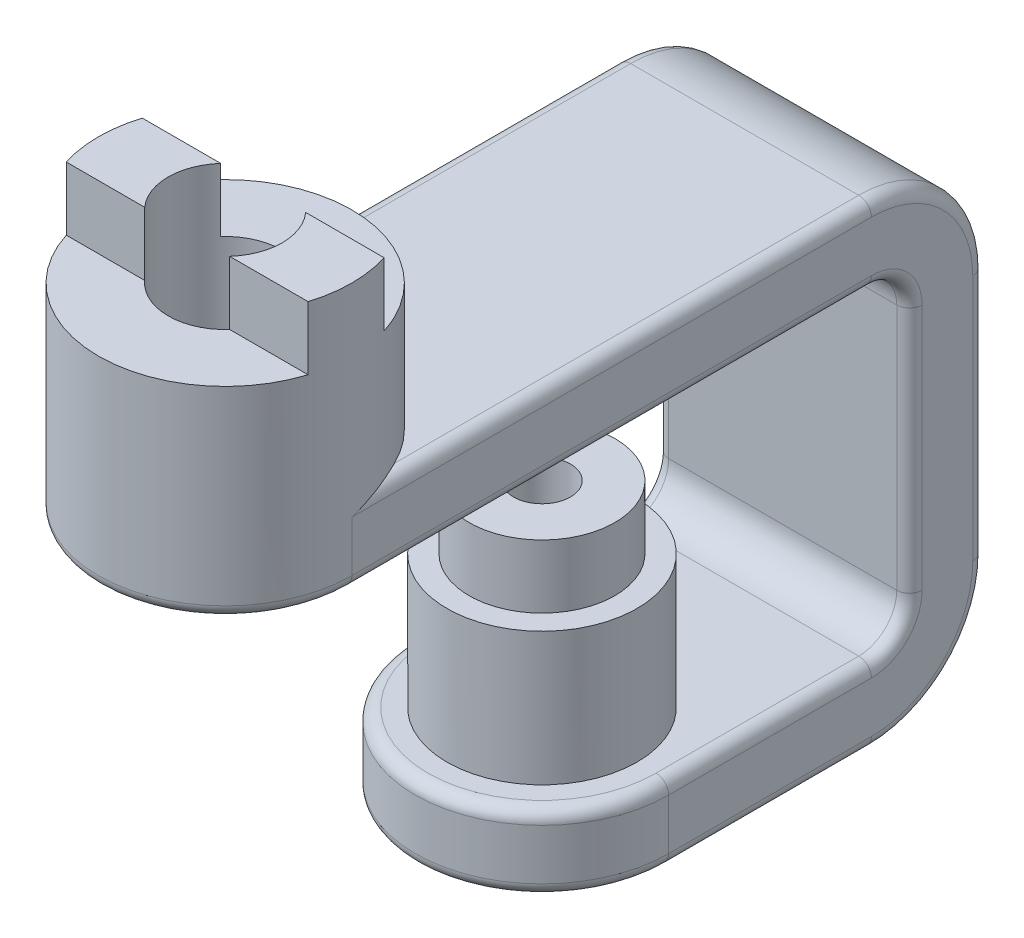
from build123d import *

# Parameters (mm, degrees)
EXTRUDE_THIN1_DEPTH                       = 20
SKETCH2_R                                 = 20
BOSS_EXTRUDE1_DEPTH                       = 42
FILLET1_RADIUS                            = 20
FILLET1_LENGTH                            = 12
SKETCH3_R                                 = 15
BOSS_EXTRUDE2_DEPTH                       = 21
SKETCH4_R                                 = 11.5
BOSS_EXTRUDE3_DEPTH                       = 10
CUT_EXTRUDE1_START                        = -10
CUT_EXTRUDE1_DEPTH                        = 10
F_18_0_18_DIAMETER_HOLE1_D                = 18
CBORE_FOR_M8_HEX_HEAD_BOLT1_OUTLINE_R     = 4.5
CBORE_FOR_M8_HEX_HEAD_BOLT1_DEPTH         = 43
CBORE_FOR_M8_HEX_HEAD_BOLT1_2_OUTLINE_R   = 9.005
CBORE_FOR_M8_HEX_HEAD_BOLT1_2_OUTLINE_R_2 = 4.5
CBORE_FOR_M8_HEX_HEAD_BOLT1_2_DEPTH       = 5.68
FILLET2_R                                 = 2


# Read off the part's stored shape, not the designer's step: CBORE for M8 Hex Head Bolt1
with BuildPart() as part:
    # Sketch1 → Extrude-Thin1 (new, symmetric)
    with BuildSketch(Plane(origin=(0, 0, 0), x_dir=(0, 0, -1), z_dir=(1, 0, 0))):
        with BuildLine():
            Line((0, 0), (52, 0))
            ThreePointArc((52, 0), (64.727922061, 5.272077939), (70, 18))
            Line((70, 18), (70, 57))
            ThreePointArc((70, 57), (64.727922061, 69.727922061), (52, 75))
            Line((52, 75), (-30, 75))
            Line((-30, 75), (-30, 63))
            Line((-30, 63), (52, 63))
            ThreePointArc((52, 63), (56.242640687, 61.242640687), (58, 57))
            Line((58, 57), (58, 18))
            ThreePointArc((58, 18), (56.242640687, 13.757359313), (52, 12))
            Line((52, 12), (0, 12))
            Line((0, 12), (0, 0))
        make_face()
    extrude(amount=EXTRUDE_THIN1_DEPTH, both=True)

    # Sketch2 → Boss-Extrude1 (add)
    with BuildSketch(Plane.XZ.offset(-63)):
        with Locations(Location((0, 30, 0), (0, 0, 270))):
            Circle(SKETCH2_R)
    extrude(amount=-BOSS_EXTRUDE1_DEPTH)

    # Fillet1: full round fillet: the end face becomes a half cylinder, R = half its width
    fillet1_face = Plane((0, 6, 0), x_dir=(0, -1, 0), z_dir=(0, 0, 1))  # on the end face: x along it, z out of the body
    fillet1_slab = fillet1_face.offset(-FILLET1_RADIUS / 2) * Box(FILLET1_LENGTH, 2 * FILLET1_RADIUS, FILLET1_RADIUS, mode=Mode.PRIVATE)  # the body's end, R deep
    fillet1_round = Plane((0, 6, -20), x_dir=(0, 0, 1), z_dir=(0, -1, 0)) * Cylinder(FILLET1_RADIUS, FILLET1_LENGTH, mode=Mode.PRIVATE)  # its axis R under the face
    add(fillet1_slab - fillet1_round, mode=Mode.SUBTRACT)

    # Sketch3 → Boss-Extrude2 (add)
    with BuildSketch(Plane(origin=(0, 12, 0), x_dir=(1, 0, 0), z_dir=(0, 1, 0))):
        with Locations(Location((0, 20, 0), (0, 0, 90))):
            Circle(SKETCH3_R)
    extrude(amount=BOSS_EXTRUDE2_DEPTH)

    # Sketch4 → Boss-Extrude3 (add)
    with BuildSketch(Plane(origin=(0, 33, 0), x_dir=(1, 0, 0), z_dir=(0, 1, 0))):
        with Locations(Location((0, 20, 0), (0, 0, 90))):
            Circle(SKETCH4_R)
    extrude(amount=BOSS_EXTRUDE3_DEPTH)

    # Sketch5 → Cut-Extrude1 (cut)
    with BuildSketch(Plane(origin=(0, 105, 0), x_dir=(1, 0, 0), z_dir=(0, 1, 0)).offset(CUT_EXTRUDE1_START)):
        with BuildLine():
            Line((-19.078784028, -24), (19.078784028, -24))
            ThreePointArc((19.078784028, -24), (0, -10), (-19.078784028, -24))
        make_face()
        with BuildLine():
            Line((-19.078784028, -36), (19.078784028, -36))
            ThreePointArc((19.078784028, -36), (0, -50), (-19.078784028, -36))
        make_face()
    extrude(amount=CUT_EXTRUDE1_DEPTH, mode=Mode.SUBTRACT)

    # Ø18.0 (18) Diameter Hole1 (through all)
    with Locations(Plane(origin=(0, 63, 0), x_dir=(-1, 0, 0), z_dir=(0, -1, 0))):
        with Locations((0, -30)):
            Hole(F_18_0_18_DIAMETER_HOLE1_D / 2)

    # CBORE for M8 Hex Head Bolt1 outline → CBORE for M8 Hex Head Bolt1 (cut)
    with BuildSketch(Plane(origin=(0, 0, 0), x_dir=(1, 0, 0), z_dir=(0, 1, 0))):
        with Locations((0, 20)):
            Circle(CBORE_FOR_M8_HEX_HEAD_BOLT1_OUTLINE_R)
    extrude(amount=CBORE_FOR_M8_HEX_HEAD_BOLT1_DEPTH, mode=Mode.SUBTRACT)

    # CBORE for M8 Hex Head Bolt1 2 outline → CBORE for M8 Hex Head Bolt1 2 (cut)
    with BuildSketch(Plane(origin=(0, 0, 0), x_dir=(1, 0, 0), z_dir=(0, 1, 0))):
        with Locations((0, 20)):
            Circle(CBORE_FOR_M8_HEX_HEAD_BOLT1_2_OUTLINE_R)
        with Locations((0, 20)):
            Circle(CBORE_FOR_M8_HEX_HEAD_BOLT1_2_OUTLINE_R_2, mode=Mode.SUBTRACT)
    extrude(amount=CBORE_FOR_M8_HEX_HEAD_BOLT1_2_DEPTH, mode=Mode.SUBTRACT)

    # Fillet2
    # the kernel refuses this fillet: 2 mm, written as the material it takes off along each edge
    with BuildSketch(Plane(origin=(20, 63, 30), x_dir=(0, 1, 0), z_dir=(0, 0, -1))) as fillet2_piece_1:
        with BuildLine():
            CenterArc((FILLET2_R, -FILLET2_R), FILLET2_R, 90, 90)
            Line((0, -FILLET2_R), (0, 0))
            Line((0, 0), (FILLET2_R, 0))
        make_face()
    extrude(amount=82, mode=Mode.SUBTRACT)
    with BuildSketch(Plane(origin=(-20, 18, -52), x_dir=(0, 0, -1), z_dir=(0, 1, 0))) as fillet2_piece_2:
        with BuildLine():
            CenterArc((6 + FILLET2_R, -FILLET2_R), FILLET2_R, 90, 90)
            Line((6 + FILLET2_R, 0), (6, 0))
            Line((6, 0), (6, -FILLET2_R))
        make_face()
    revolve(axis=Axis((-20, 18, -52), (-1, 0, 0)), revolution_arc=90, mode=Mode.SUBTRACT)
    with BuildSketch(Plane(origin=(-20, 57, -58), x_dir=(0, 0, -1), z_dir=(0, -1, 0)), Plane(origin=(-20, 18, -70), x_dir=(0, 0, 1), z_dir=(0, 1, 0))) as fillet2_piece_3:
        with BuildLine():
            CenterArc((FILLET2_R, FILLET2_R), FILLET2_R, 180, 90)
            Line((0, FILLET2_R), (0, 0))
            Line((0, 0), (FILLET2_R, 0))
        make_face()
    extrude(amount=39, mode=Mode.SUBTRACT)
    with BuildSketch(Plane(origin=(-20, 57, -52), x_dir=(0, 1, 0), z_dir=(0, 0, 1))) as fillet2_piece_4:
        with BuildLine():
            CenterArc((6 + FILLET2_R, -FILLET2_R), FILLET2_R, 90, 90)
            Line((6, -FILLET2_R), (6, 0))
            Line((6, 0), (6 + FILLET2_R, 0))
        make_face()
    revolve(axis=Axis((-20, 57, -52), (-1, 0, 0)), revolution_arc=90, mode=Mode.SUBTRACT)
    with BuildSketch(Plane(origin=(-20, 63, 30), x_dir=(0, 1, 0), z_dir=(0, 0, -1))) as fillet2_piece_5:
        with BuildLine():
            CenterArc((FILLET2_R, FILLET2_R), FILLET2_R, 180, 90)
            Line((0, FILLET2_R), (0, 0))
            Line((0, 0), (FILLET2_R, 0))
        make_face()
    extrude(amount=82, mode=Mode.SUBTRACT)
    with BuildSketch(Plane(origin=(-20, 75, -52), x_dir=(0, -1, 0), z_dir=(0, 0, 1))) as fillet2_piece_6_section:
        with BuildLine():
            CenterArc((FILLET2_R, FILLET2_R), FILLET2_R, 180, 90)
            Line((0, FILLET2_R), (0, 0))
            Line((0, 0), (FILLET2_R, 0))
        make_face()
    fillet2_piece_6 = extrude(amount=87, mode=Mode.PRIVATE)
    fillet2_piece_6 = fillet2_piece_6 - Plane(origin=(0, 74.534164155, 30), x_dir=(0, 0, -1), z_dir=(0, -1, 0)) * Cylinder(20, 182, mode=Mode.PRIVATE)
    add(fillet2_piece_6, mode=Mode.SUBTRACT)
    with BuildSketch(Plane(origin=(20, 57, -52), x_dir=(0, 1, 0), z_dir=(0, 0, 1))) as fillet2_piece_7:
        with BuildLine():
            CenterArc((6 + FILLET2_R, FILLET2_R), FILLET2_R, 180, 90)
            Line((6, FILLET2_R), (6, 0))
            Line((6, 0), (6 + FILLET2_R, 0))
        make_face()
    revolve(axis=Axis((20, 57, -52), (-1, 0, 0)), revolution_arc=90, mode=Mode.SUBTRACT)
    with BuildSketch(Plane(origin=(20, 57, -58), x_dir=(0, 0, -1), z_dir=(0, -1, 0)), Plane(origin=(20, 18, -70), x_dir=(0, 0, 1), z_dir=(0, 1, 0))) as fillet2_piece_8:
        with BuildLine():
            CenterArc((FILLET2_R, -FILLET2_R), FILLET2_R, 90, 90)
            Line((0, -FILLET2_R), (0, 0))
            Line((0, 0), (FILLET2_R, 0))
        make_face()
    extrude(amount=39, mode=Mode.SUBTRACT)
    with BuildSketch(Plane(origin=(20, 18, -52), x_dir=(0, 0, -1), z_dir=(0, 1, 0))) as fillet2_piece_9:
        with BuildLine():
            CenterArc((6 + FILLET2_R, FILLET2_R), FILLET2_R, 180, 90)
            Line((6 + FILLET2_R, 0), (6, 0))
            Line((6, 0), (6, FILLET2_R))
        make_face()
    revolve(axis=Axis((20, 18, -52), (-1, 0, 0)), revolution_arc=90, mode=Mode.SUBTRACT)
    with BuildSketch(Plane(origin=(20, 18, -52), x_dir=(0, -1, 0), z_dir=(0, 0, 1))) as fillet2_piece_10:
        with BuildLine():
            CenterArc((18 - FILLET2_R, -FILLET2_R), FILLET2_R, 0, 90)
            Line((18, -FILLET2_R), (18, 0))
            Line((18, 0), (18 - FILLET2_R, 0))
        make_face()
    revolve(axis=Axis((20, 18, -52), (1, 0, 0)), revolution_arc=90, mode=Mode.SUBTRACT)
    with BuildSketch(Plane(origin=(0, 63, 30), x_dir=(1, 0, 0), z_dir=(0, 0, -1))) as fillet2_piece_11:
        with BuildLine():
            CenterArc((20 - FILLET2_R, -FILLET2_R), FILLET2_R, 0, 90)
            Line((20, -FILLET2_R), (20, 0))
            Line((20, 0), (20 - FILLET2_R, 0))
        make_face()
    revolve(axis=Axis((0, 63, 30), (0, -1, 0)), revolution_arc=180, mode=Mode.SUBTRACT)
    with BuildSketch(Plane(origin=(20, 57, -52), x_dir=(0, 0, -1), z_dir=(0, -1, 0))) as fillet2_piece_12:
        with BuildLine():
            CenterArc((18 - FILLET2_R, -FILLET2_R), FILLET2_R, 0, 90)
            Line((18, -FILLET2_R), (18, 0))
            Line((18, 0), (18 - FILLET2_R, 0))
        make_face()
    revolve(axis=Axis((20, 57, -52), (1, 0, 0)), revolution_arc=90, mode=Mode.SUBTRACT)
    with BuildSketch(Plane(origin=(20, 12, -52), x_dir=(-1, 0, 0), z_dir=(0, 0, 1)), Plane(origin=(-20, 0, -20), x_dir=(0, 1, 0), z_dir=(0, 0, -1))) as fillet2_piece_13:
        with BuildLine():
            CenterArc((FILLET2_R, FILLET2_R), FILLET2_R, 180, 90)
            Line((0, FILLET2_R), (0, 0))
            Line((0, 0), (FILLET2_R, 0))
        make_face()
    extrude(amount=32, mode=Mode.SUBTRACT)
    with BuildSketch(Plane(origin=(20, 0, -20), x_dir=(0, 1, 0), z_dir=(0, 0, -1)), Plane(origin=(-20, 12, -52), x_dir=(1, 0, 0), z_dir=(0, 0, 1))) as fillet2_piece_14:
        with BuildLine():
            CenterArc((FILLET2_R, -FILLET2_R), FILLET2_R, 90, 90)
            Line((0, -FILLET2_R), (0, 0))
            Line((0, 0), (FILLET2_R, 0))
        make_face()
    extrude(amount=32, mode=Mode.SUBTRACT)
    with BuildSketch(Plane(origin=(20, 75, -52), x_dir=(0, -1, 0), z_dir=(0, 0, 1))) as fillet2_piece_15_section:
        with BuildLine():
            CenterArc((FILLET2_R, -FILLET2_R), FILLET2_R, 90, 90)
            Line((0, -FILLET2_R), (0, 0))
            Line((0, 0), (FILLET2_R, 0))
        make_face()
    fillet2_piece_15 = extrude(amount=87, mode=Mode.PRIVATE)
    fillet2_piece_15 = fillet2_piece_15 - Plane(origin=(0, 74.534164154, 30), x_dir=(0, 0, -1), z_dir=(0, -1, 0)) * Cylinder(20, 182, mode=Mode.PRIVATE)
    add(fillet2_piece_15, mode=Mode.SUBTRACT)
    with BuildSketch(Plane(origin=(0, 12, -20), x_dir=(-1, 0, 0), z_dir=(0, 0, -1))) as fillet2_piece_16:
        with BuildLine():
            CenterArc((20 - FILLET2_R, -FILLET2_R), FILLET2_R, 0, 90)
            Line((20, -FILLET2_R), (20, 0))
            Line((20, 0), (20 - FILLET2_R, 0))
        make_face()
    revolve(axis=Axis((0, 12, -20), (0, 1, 0)), revolution_arc=180, mode=Mode.SUBTRACT)
    with BuildSketch(Plane(origin=(0, 0, -20), x_dir=(-1, 0, 0), z_dir=(0, 0, -1))) as fillet2_piece_17:
        with BuildLine():
            CenterArc((20 - FILLET2_R, FILLET2_R), FILLET2_R, 270, 90)
            Line((20 - FILLET2_R, 0), (20, 0))
            Line((20, 0), (20, FILLET2_R))
        make_face()
    revolve(axis=Axis((0, 0, -20), (0, 1, 0)), revolution_arc=180, mode=Mode.SUBTRACT)
    with BuildSketch(Plane(origin=(-20, 57, -52), x_dir=(0, 0, -1), z_dir=(0, -1, 0))) as fillet2_piece_18:
        with BuildLine():
            CenterArc((18 - FILLET2_R, FILLET2_R), FILLET2_R, 270, 90)
            Line((18, FILLET2_R), (18, 0))
            Line((18, 0), (18 - FILLET2_R, 0))
        make_face()
    revolve(axis=Axis((-20, 57, -52), (1, 0, 0)), revolution_arc=90, mode=Mode.SUBTRACT)
    with BuildSketch(Plane(origin=(-20, 18, -52), x_dir=(0, -1, 0), z_dir=(0, 0, 1))) as fillet2_piece_19:
        with BuildLine():
            CenterArc((18 - FILLET2_R, FILLET2_R), FILLET2_R, 270, 90)
            Line((18, FILLET2_R), (18, 0))
            Line((18, 0), (18 - FILLET2_R, 0))
        make_face()
    revolve(axis=Axis((-20, 18, -52), (1, 0, 0)), revolution_arc=90, mode=Mode.SUBTRACT)


solid = part.part
